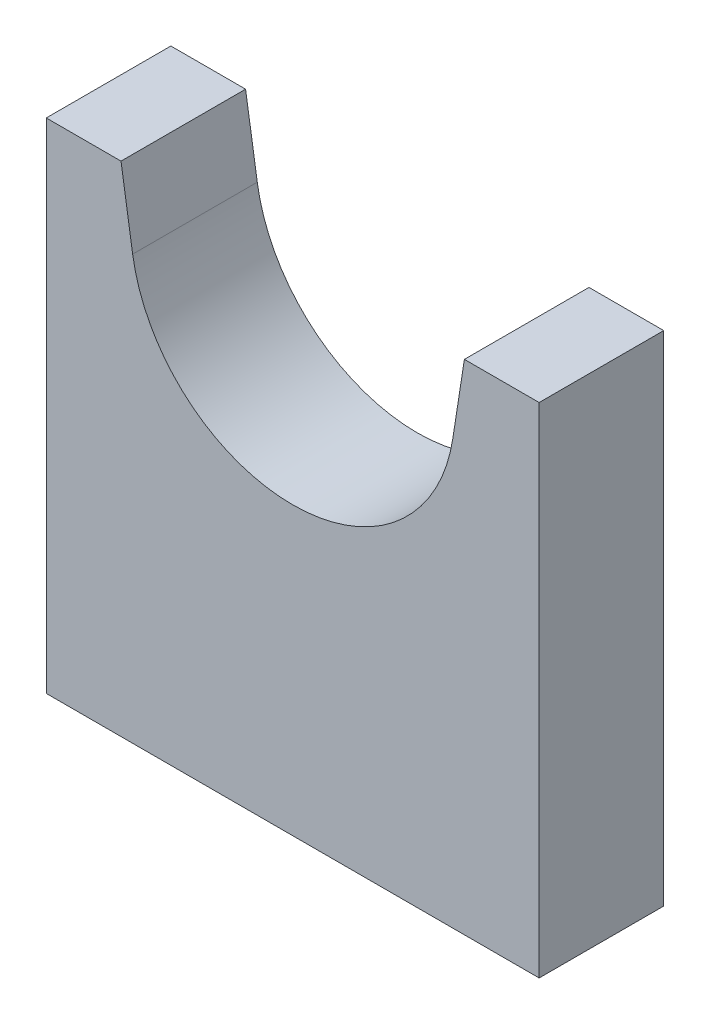
from build123d import *

# Parameters (mm, degrees)
BOSS_EXTRUDE1_DEPTH = 2.5


with BuildPart() as part:
    # Sketch1 → Boss-Extrude1 (new, symmetric)
    with BuildSketch(Plane.XY):
        with BuildLine():
            Line((-6.422616289, -1), (-6.889715656, 2))
            Line((-6.889715656, 2), (-9.889715656, 2))
            Line((-9.889715656, 2), (-9.889715656, -18))
            Line((-9.889715656, -18), (9.889715656, -18))
            Line((9.889715656, -18), (9.889715656, 2))
            Line((9.889715656, 2), (6.889715656, 2))
            Line((6.889715656, 2), (6.422616289, -1))
            ThreePointArc((6.422616289, -1), (0, -6.5), (-6.422616289, -1))
        make_face()
    extrude(amount=BOSS_EXTRUDE1_DEPTH, both=True)


solid = part.part
